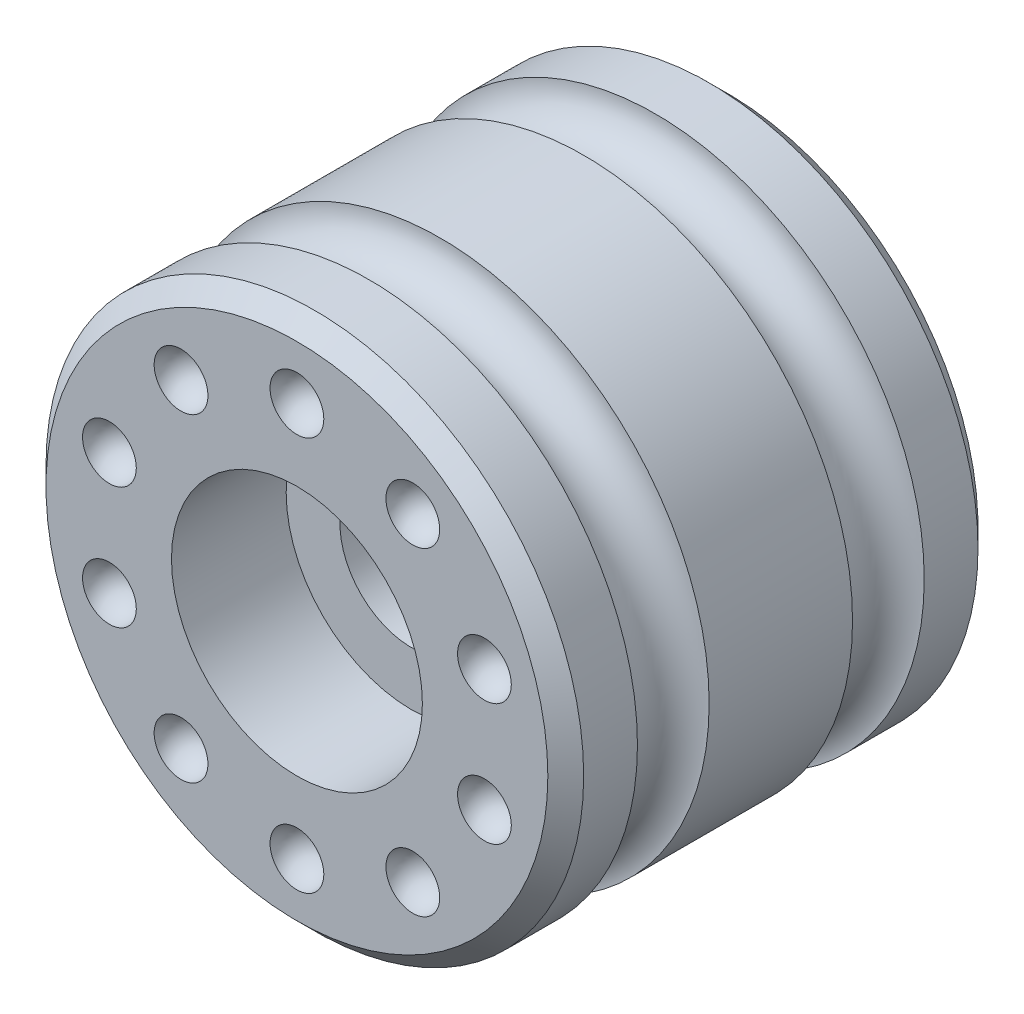
from build123d import *

# Parameters (mm, degrees)
SKETCH1_R                = 7.5
BOSS_EXTRUDE1_DEPTH      = 6
SKETCH3_R                = 1
SKETCH2_R                = 3.5
CUT_EXTRUDE1_DEPTH       = 3.2
CHAMFER1_SIZE            = 0.5
SKETCH4_R                = 2
CUT_EXTRUDE2_DEPTH       = 12.0788086
CIRPATTERN1_COUNT        = 10
CHAMFER1_OF_MIRROR2_SIZE = 0.5


with BuildPart() as part:
    # Sketch1 → Boss-Extrude1 (new body)
    with BuildSketch(Plane.XY):
        Circle(SKETCH1_R)
    boss_extrude1 = extrude(amount=BOSS_EXTRUDE1_DEPTH)

    # Sketch3 → Cut-Revolve1 (revolve, cut)
    with BuildSketch(Plane(origin=(0, 0, 0), x_dir=(0, 0, -1), z_dir=(1, 0, 0))):
        with Locations((-3, 7.5)):
            Circle(SKETCH3_R)
    cut_revolve1 = revolve(axis=Axis((0, 0, -0.35), (0, 0, 1)), mode=Mode.SUBTRACT)

    # Sketch2 → Cut-Extrude1 (cut)
    with BuildSketch(Plane.XY.offset(6)):
        Circle(SKETCH2_R)
    cut_extrude1 = extrude(amount=-CUT_EXTRUDE1_DEPTH, mode=Mode.SUBTRACT)

    # Chamfer1
    chamfer1_edges = [part.edges().sort_by_distance(p)[0] for p in [
        (-7.5, 0, 6),
    ]]
    chamfer(chamfer1_edges, length=CHAMFER1_SIZE)

    # Sketch4 → Cut-Extrude2 (cut, through all)
    with BuildSketch(Plane.XY.offset(2.8)):
        Circle(SKETCH4_R)
    cut_extrude2 = extrude(amount=-CUT_EXTRUDE2_DEPTH, mode=Mode.SUBTRACT)

    # Sketch6 → Cut-Revolve2 (revolve, cut)
    with BuildSketch(Plane(origin=(0, 0, 0), x_dir=(0, 0, -1), z_dir=(1, 0, 0))):
        with BuildLine():
            Line((-6, 4.75), (-6, 6.25))
            ThreePointArc((-6, 6.25), (-6.75, 5.5), (-6, 4.75))
        make_face()
    cut_revolve2 = revolve(axis=Axis((0, 55, 6), (0, -1, 0)), mode=Mode.SUBTRACT)

    # CirPattern1: Cut-Revolve2 ×10 about axis
    cirpattern1_axis = Axis((0, 0, -0.35), (0, 0, 1))
    for i in range(1, CIRPATTERN1_COUNT):
        add(cut_revolve2.rotate(cirpattern1_axis, i * 360 / CIRPATTERN1_COUNT), mode=Mode.SUBTRACT)

    # Mirror2: Boss-Extrude1, Cut-Revolve1, Cut-Extrude1, Cut-Extrude2, Cut-Revolve2 across plane
    add(boss_extrude1.mirror(Plane.XY))
    add(cut_revolve1.mirror(Plane.XY), mode=Mode.SUBTRACT)
    add(cut_extrude1.mirror(Plane.XY), mode=Mode.SUBTRACT)
    add(cut_extrude2.mirror(Plane.XY), mode=Mode.SUBTRACT)
    add(cut_revolve2.mirror(Plane.XY), mode=Mode.SUBTRACT)

    # Mirror2 copy 1 sketch → Mirror2 copy 1 (revolve, cut)
    with BuildSketch(Plane(origin=(0, 0, 0), x_dir=(0, 0, 1), z_dir=(0.8090169943749475, 0.5877852522924731, 0))):
        with BuildLine():
            Line((-6, -4.75), (-6, -6.25))
            ThreePointArc((-6, -6.25), (-6.75, -5.5), (-6, -4.75))
        make_face()
    revolve(axis=Axis((-32.328188876, 44.495934691, -6), (-0.5877852522924731, 0.8090169943749475, 0)), mode=Mode.SUBTRACT)

    # Mirror2 copy 2 sketch → Mirror2 copy 2 (revolve, cut)
    with BuildSketch(Plane(origin=(0, 0, 0), x_dir=(0, 0, 1), z_dir=(0.30901699437494745, 0.9510565162951535, 0))):
        with BuildLine():
            Line((-6, -4.75), (-6, -6.25))
            ThreePointArc((-6, -6.25), (-6.75, -5.5), (-6, -4.75))
        make_face()
    revolve(axis=Axis((-52.308108396, 16.995934691, -6), (-0.9510565162951535, 0.30901699437494745, 0)), mode=Mode.SUBTRACT)

    # Mirror2 copy 3 sketch → Mirror2 copy 3 (revolve, cut)
    with BuildSketch(Plane(origin=(0, 0, 0), x_dir=(0, 0, 1), z_dir=(-0.30901699437494734, 0.9510565162951536, 0))):
        with BuildLine():
            Line((-6, -4.75), (-6, -6.25))
            ThreePointArc((-6, -6.25), (-6.75, -5.5), (-6, -4.75))
        make_face()
    revolve(axis=Axis((-52.308108396, -16.995934691, -6), (-0.9510565162951536, -0.30901699437494734, 0)), mode=Mode.SUBTRACT)

    # Mirror2 copy 4 sketch → Mirror2 copy 4 (revolve, cut)
    with BuildSketch(Plane(origin=(0, 0, 0), x_dir=(0, 0, 1), z_dir=(-0.8090169943749473, 0.5877852522924732, 0))):
        with BuildLine():
            Line((-6, -4.75), (-6, -6.25))
            ThreePointArc((-6, -6.25), (-6.75, -5.5), (-6, -4.75))
        make_face()
    revolve(axis=Axis((-32.328188876, -44.495934691, -6), (-0.5877852522924732, -0.8090169943749473, 0)), mode=Mode.SUBTRACT)

    # Mirror2 copy 5 sketch → Mirror2 copy 5 (revolve, cut)
    with BuildSketch(Plane.ZY):
        with BuildLine():
            Line((-6, -4.75), (-6, -6.25))
            ThreePointArc((-6, -6.25), (-6.75, -5.5), (-6, -4.75))
        make_face()
    revolve(axis=Axis((0, -55, -6), (0, -1, 0)), mode=Mode.SUBTRACT)

    # Mirror2 copy 6 sketch → Mirror2 copy 6 (revolve, cut)
    with BuildSketch(Plane(origin=(0, 0, 0), x_dir=(0, 0, 1), z_dir=(-0.8090169943749476, -0.587785252292473, 0))):
        with BuildLine():
            Line((-6, -4.75), (-6, -6.25))
            ThreePointArc((-6, -6.25), (-6.75, -5.5), (-6, -4.75))
        make_face()
    revolve(axis=Axis((32.328188876, -44.495934691, -6), (0.587785252292473, -0.8090169943749476, 0)), mode=Mode.SUBTRACT)

    # Mirror2 copy 7 sketch → Mirror2 copy 7 (revolve, cut)
    with BuildSketch(Plane(origin=(0, 0, 0), x_dir=(0, 0, 1), z_dir=(-0.30901699437494756, -0.9510565162951535, 0))):
        with BuildLine():
            Line((-6, -4.75), (-6, -6.25))
            ThreePointArc((-6, -6.25), (-6.75, -5.5), (-6, -4.75))
        make_face()
    revolve(axis=Axis((52.308108396, -16.995934691, -6), (0.9510565162951535, -0.30901699437494756, 0)), mode=Mode.SUBTRACT)

    # Mirror2 copy 8 sketch → Mirror2 copy 8 (revolve, cut)
    with BuildSketch(Plane(origin=(0, 0, 0), x_dir=(0, 0, 1), z_dir=(0.30901699437494723, -0.9510565162951536, 0))):
        with BuildLine():
            Line((-6, -4.75), (-6, -6.25))
            ThreePointArc((-6, -6.25), (-6.75, -5.5), (-6, -4.75))
        make_face()
    revolve(axis=Axis((52.308108396, 16.995934691, -6), (0.9510565162951536, 0.30901699437494723, 0)), mode=Mode.SUBTRACT)

    # Mirror2 copy 9 sketch → Mirror2 copy 9 (revolve, cut)
    with BuildSketch(Plane(origin=(0, 0, 0), x_dir=(0, 0, 1), z_dir=(0.8090169943749473, -0.5877852522924734, 0))):
        with BuildLine():
            Line((-6, -4.75), (-6, -6.25))
            ThreePointArc((-6, -6.25), (-6.75, -5.5), (-6, -4.75))
        make_face()
    revolve(axis=Axis((32.328188876, 44.495934691, -6), (0.5877852522924734, 0.8090169943749473, 0)), mode=Mode.SUBTRACT)

    # Chamfer1 of Mirror2
    chamfer1_of_mirror2_edges = [part.edges().sort_by_distance(p)[0] for p in [
        (-7.5, 0, -6),
    ]]
    chamfer(chamfer1_of_mirror2_edges, length=CHAMFER1_OF_MIRROR2_SIZE)


solid = part.part
